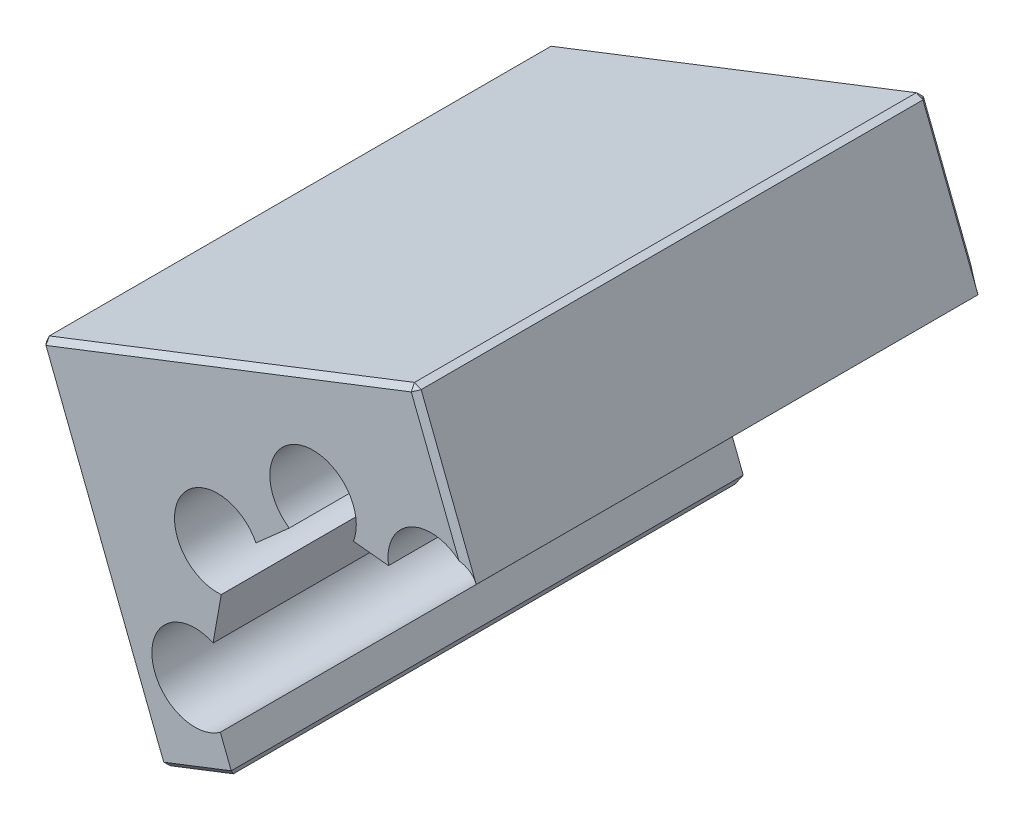
from build123d import *

# Parameters (mm, degrees)
EXTRUDE_2_DEPTH = 250
CHAMFER_1_SIZE  = 2.5


with BuildPart() as part:
    # 草圖1 → 填料-伸長2 (new body)
    with BuildSketch(Plane.XY.offset(12.605896745971167)):
        with BuildLine():
            Line((-112.11777063223668, -75.64023050952714), (-108.13973290199444, -53.16755899774324))
            ThreePointArc((-108.13973290199444, -53.16755899774324), (-128.28541716392445, -21.9976959729119), (-91.18146902098964, -22.837926640364703))
            Line((-91.18146902098964, -22.837926640364703), (-74.91518650356907, -8.426224479098595))
            ThreePointArc((-74.91518650356907, -8.426224479098595), (-69.76862631368554, 29.297285810426303), (-43.579874891032546, 1.6621703000019683))
            Line((-43.579874891032546, 1.6621703000019683), (-26.446012396901512, -0.08690302075969268))
            ThreePointArc((-26.446012396901512, -0.08690302075969268), (-11.20924853682007, 23.49241233452908), (13.857582965488481, 10.851326780396066))
            Line((13.857582965488481, 10.851326780396066), (-13.929514572378649, 82.14832405231925))
            Line((-13.929514572378649, 82.14832405231925), (-196.93306546339264, 10.825018542128108))
            Line((-196.93306546339264, 10.825018542128108), (-137.63840421554704, -141.31506357570169))
            Line((-137.63840421554704, -141.31506357570169), (-102.3514154071195, -127.56240866237148))
            Line((-102.3514154071195, -127.56240866237148), (-108.57535624014912, -111.59282810476189))
            ThreePointArc((-108.57535624014912, -111.59282810476189), (-141.90428180363014, -96.72591564369878), (-112.11777063223668, -75.64023050952714))
        make_face()
    extrude(amount=-EXTRUDE_2_DEPTH)

    # 導角1
    chamfer_1_edges = [part.edges().sort_by_distance(p)[0] for p in [
        (-105.43129001788562, 46.486671297223694, -237.39410325402883),
        (-0.03596580344504845, 46.49982541635767, -237.39410325402883),
        (-13.929514572378613, 82.14832405231927, -112.39410325402883),
        (-167.28573483946982, -65.24502251678678, -237.39410325402883),
        (-196.9330654633926, 10.825018542128118, -112.39410325402883),
        (-102.35141540711948, -127.56240866237147, -112.39410325402883),
        (-119.99490981133324, -134.43873611903658, -237.39410325402883),
        (-137.638404215547, -141.31506357570169, -112.39410325402883),
        (-119.99490981133324, -134.43873611903658, 12.605896745971167),
        (-167.28573483946982, -65.24502251678678, 12.605896745971167),
        (-105.43129001788562, 46.486671297223694, 12.605896745971167),
        (-0.03596580344504845, 46.49982541635767, 12.605896745971167),
    ]]
    chamfer(chamfer_1_edges, length=CHAMFER_1_SIZE)


solid = part.part
